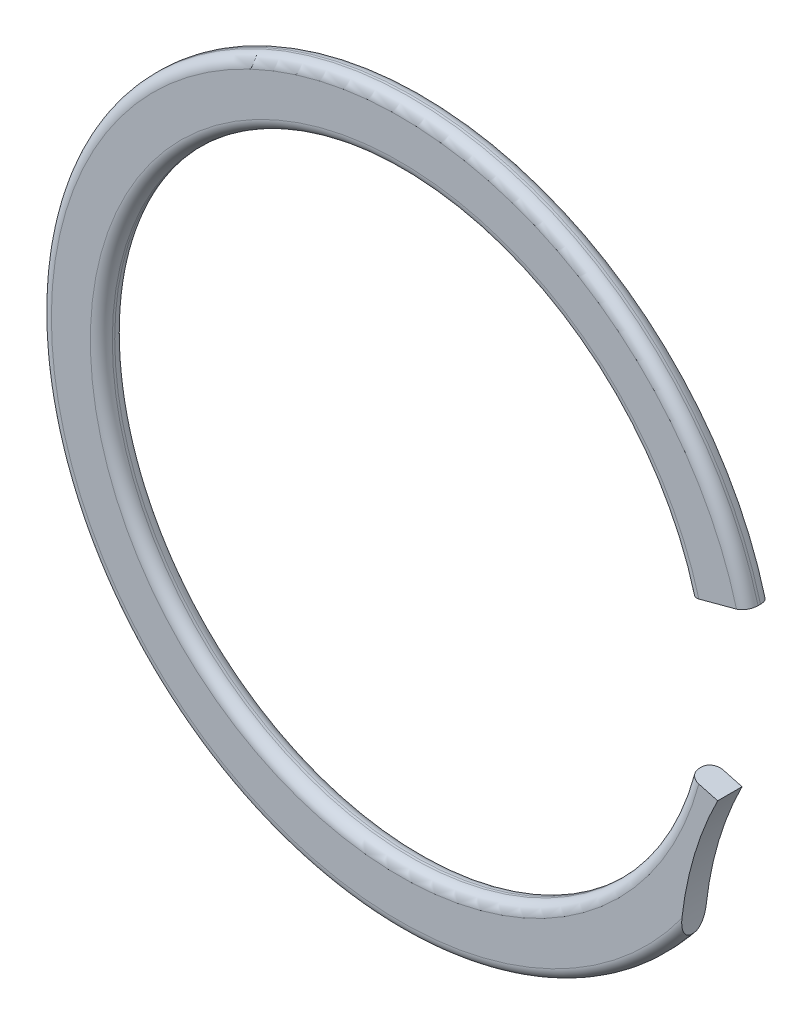
from build123d import *

# Parameters (mm, degrees)
EXTRUDE1_DEPTH = 0.2286
FILLET1_R      = 0.20574


with BuildPart() as part:
    # Sketch2 → Extrude1 (new, symmetric)
    with BuildSketch(Plane.XY):
        with BuildLine():
            Line((5.409860775, -1.449567826), (5.961887385, -1.59748291))
            ThreePointArc((5.961887385, -1.59748291), (5.473784344, -2.873056661), (5.258707102, -4.221787454))
            ThreePointArc((5.258707102, -4.221787454), (-6.599278553, 1.388168677), (6.513913995, 1.745397994))
            Line((6.513913995, 1.745397994), (5.409860775, 1.449567826))
            ThreePointArc((5.409860775, 1.449567826), (-5.6007, 0), (5.409860775, -1.449567826))
        make_face()
    extrude(amount=EXTRUDE1_DEPTH, both=True)

    # Fillet1
    fillet1_edges = [part.edges().sort_by_distance(p)[0] for p in [
        (-6.599278553, 1.388168677, -0.2286),
        (-6.599278553, 1.388168677, 0.2286),
        (-5.6007, 0, -0.2286),
        (-5.6007, 0, 0.2286),
    ]]
    fillet(fillet1_edges, radius=FILLET1_R)


solid = part.part
